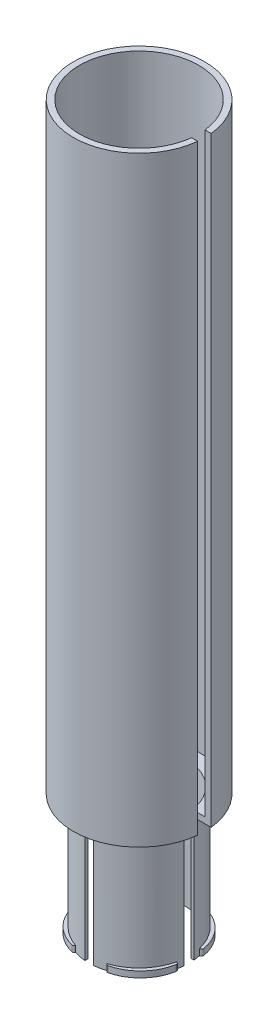
from build123d import *

# Parameters (mm, degrees)
SKETCH1_R           = 21.59
BOSS_EXTRUDE1_DEPTH = 200
SHELL1_T            = 2
CUT_EXTRUDE1_START  = 20
CUT_EXTRUDE1_DEPTH  = 5
SKETCH4_R           = 16.5
BOSS_EXTRUDE2_DEPTH = 40
SKETCH7_R           = 15.5
CUT_EXTRUDE4_DEPTH  = 62
SKETCH8_W           = 2.785852998
SKETCH8_H           = 5.87658936
SKETCH8_W_2         = 8.878050256
SKETCH8_H_2         = 3.207420782
SKETCH8_W_3         = 2.758641046
SKETCH8_H_3         = 8.505589864
CUT_EXTRUDE5_DEPTH  = 203.317216766
BOSS_EXTRUDE4_DEPTH = 2
SKETCH10_R          = 21.59
CUT_EXTRUDE7_DEPTH  = 2.5


with BuildPart() as part:
    # Sketch1 → Boss-Extrude1 (new body)
    with BuildSketch(Plane(origin=(0, 0, 0), x_dir=(1, 0, 0), z_dir=(0, 1, 0))):
        Circle(SKETCH1_R)
    extrude(amount=BOSS_EXTRUDE1_DEPTH)

    # Shell1 (no face opened: a closed hollow body)
    add(offset(amount=-SHELL1_T, mode=Mode.PRIVATE), mode=Mode.SUBTRACT)

    # Sketch2 → Cut-Extrude1 (cut, symmetric)
    with BuildSketch(Plane(origin=(0, 0, 0), x_dir=(0, 0, -1), z_dir=(1, 0, 0)).offset(CUT_EXTRUDE1_START)):
        Polygon((2.213988381, 104.269834735), (2.213988381, 0), (-2.213988381, 0), (-2.213988381, 104.269834735), (-2.213988381, 199.79439609), (2.213988381, 199.79439609), align=None)
    extrude(amount=CUT_EXTRUDE1_DEPTH, both=True, mode=Mode.SUBTRACT)

    # Sketch4 → Boss-Extrude2 (add)
    with BuildSketch(Plane.XZ):
        Circle(SKETCH4_R)
    extrude(amount=BOSS_EXTRUDE2_DEPTH)

    # Sketch7 → Cut-Extrude4 (cut)
    with BuildSketch(Plane(origin=(0, -40, 0), x_dir=(-1, 0, 0), z_dir=(0, -1, 0))):
        Circle(SKETCH7_R)
    extrude(amount=-CUT_EXTRUDE4_DEPTH, mode=Mode.SUBTRACT)

    # Sketch8 → Cut-Extrude5 (cut, through all)
    with BuildSketch(Plane(origin=(0, 0, 0), x_dir=(1, 0, 0), z_dir=(0, 1, 0))):
        with Locations((0, 20.108138302)):
            Rectangle(SKETCH8_W, SKETCH8_H)
        with Locations((18.709836445, -0.001004202)):
            Rectangle(SKETCH8_W_2, SKETCH8_H_2)
        with Locations((0.013605976, -18.452209414)):
            Rectangle(SKETCH8_W_3, SKETCH8_H_3)
        with Locations((-18.709836445, -0.001004202)):
            Rectangle(SKETCH8_W_2, SKETCH8_H_2)
    extrude(amount=-CUT_EXTRUDE5_DEPTH, mode=Mode.SUBTRACT)

    # Sketch9 → Boss-Extrude4 (add)
    with BuildSketch(Plane.XZ.offset(40)):
        with BuildLine():
            ThreePointArc((16.726333299, 4.561841417), (13.056013579, 11.944688127), (5.932226465, 16.095510881))
            ThreePointArc((5.932226465, 16.095510881), (5.137631387, 15.609709062), (5.623433206, 14.815113985))
            ThreePointArc((5.623433206, 14.815113985), (12.094357446, 11.044695365), (15.428308962, 4.338453169))
            ThreePointArc((15.428308962, 4.338453169), (16.189015254, 3.801135125), (16.726333299, 4.561841417))
        make_face()
        with BuildLine():
            ThreePointArc((16.726333299, -4.561841417), (13.056013579, -11.944688127), (5.932226465, -16.095510881))
            ThreePointArc((5.932226465, -16.095510881), (5.137631387, -15.609709062), (5.623433206, -14.815113985))
            ThreePointArc((5.623433206, -14.815113985), (12.094357446, -11.044695365), (15.428308962, -4.338453169))
            ThreePointArc((15.428308962, -4.338453169), (16.189015254, -3.801135125), (16.726333299, -4.561841417))
        make_face()
        with BuildLine():
            ThreePointArc((-16.726333299, -4.561841417), (-13.056013579, -11.944688127), (-5.932226465, -16.095510881))
            ThreePointArc((-5.932226465, -16.095510881), (-5.137631387, -15.609709062), (-5.623433206, -14.815113985))
            ThreePointArc((-5.623433206, -14.815113985), (-12.094357446, -11.044695365), (-15.428308962, -4.338453169))
            ThreePointArc((-15.428308962, -4.338453169), (-16.189015254, -3.801135125), (-16.726333299, -4.561841417))
        make_face()
        with BuildLine():
            ThreePointArc((-16.726333299, 4.561841417), (-13.056013579, 11.944688127), (-5.932226465, 16.095510881))
            ThreePointArc((-5.932226465, 16.095510881), (-5.137631387, 15.609709062), (-5.623433206, 14.815113985))
            ThreePointArc((-5.623433206, 14.815113985), (-12.094357446, 11.044695365), (-15.428308962, 4.338453169))
            ThreePointArc((-15.428308962, 4.338453169), (-16.189015254, 3.801135125), (-16.726333299, 4.561841417))
        make_face()
    extrude(amount=-BOSS_EXTRUDE4_DEPTH)

    # Sketch10 → Cut-Extrude7 (cut, symmetric)
    with BuildSketch(Plane(origin=(0, 200, 0), x_dir=(1, 0, 0), z_dir=(0, 1, 0))):
        Circle(SKETCH10_R)
    extrude(amount=CUT_EXTRUDE7_DEPTH, both=True, mode=Mode.SUBTRACT)


solid = part.part
